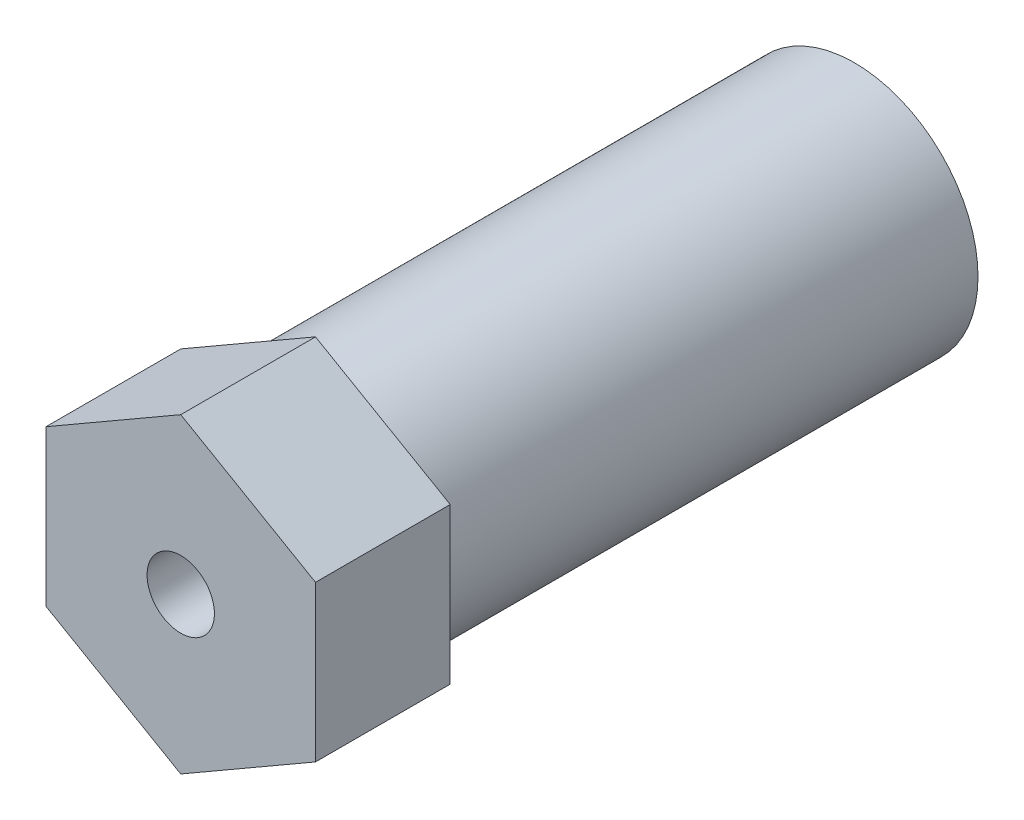
from build123d import *

# Parameters (mm, degrees)
SKETCH1_R           = 1.5
BOSS_EXTRUDE1_DEPTH = 6
SKETCH1_2_R         = 5.5
SKETCH1_2_R_2       = 1.5
BOSS_EXTRUDE3_DEPTH = 24
SKETCH2_R           = 3
CUT_EXTRUDE1_DEPTH  = 25


with BuildPart() as part:
    # Sketch1 → Boss-Extrude1 (new body)
    with BuildSketch(Plane.XY):
        Polygon((6, -3.464101615), (6, 3.464101615), (0, 6.92820323), (-6, 3.464101615), (-6, -3.464101615), (0, -6.92820323), align=None)
        Circle(SKETCH1_R, mode=Mode.SUBTRACT)
    extrude(amount=BOSS_EXTRUDE1_DEPTH)


with BuildPart() as body_2:
    # Sketch1<2> → Boss-Extrude3 (new body)
    with BuildSketch(Plane.XY):
        Circle(SKETCH1_2_R)
        Circle(SKETCH1_2_R_2, mode=Mode.SUBTRACT)
    extrude(amount=-BOSS_EXTRUDE3_DEPTH)

    # Sketch2 → Cut-Extrude1 (cut)
    with BuildSketch(Plane(origin=(0, 0, -24), x_dir=(-1, 0, 0), z_dir=(0, 0, -1))):
        Circle(SKETCH2_R)
    extrude(amount=-CUT_EXTRUDE1_DEPTH, mode=Mode.SUBTRACT)


solid = Compound([part.part, body_2.part])
